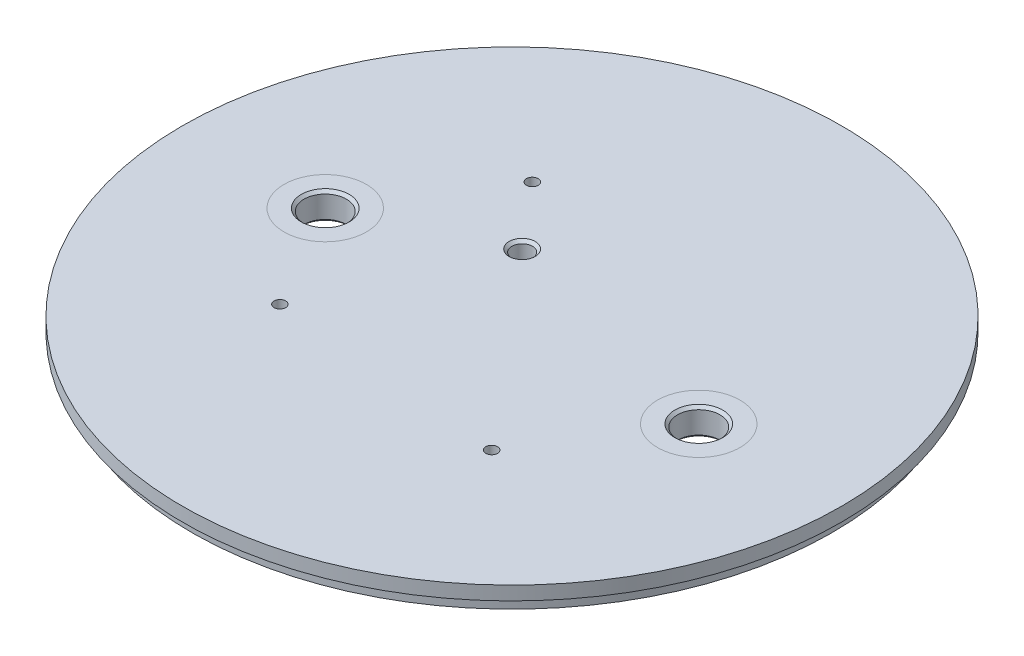
from build123d import *

# Parameters (mm, degrees)
SKETCH1_R                 = 76.2
BOSS_EXTRUDE1_DEPTH       = 6.35
TAP_DRILL_FOR_6_32_TAP1_D = 2.7051
CIRPATTERN1_COUNT         = 4
W_0_386_DIAMETER_HOLE1_D  = 9.8044
CUT_EXTRUDE4_DEPTH        = 3.175
SKETCH15_R                = 76.2
SKETCH15_R_2              = 74.041
CUT_EXTRUDE5_DEPTH        = 3.175
BODY_MOVE_COPY1_ANGLE     = 40
CHAMFER1_SIZE             = 0.635


with BuildPart() as part:
    # Sketch1 → Boss-Extrude1 (new body)
    with BuildSketch(Plane(origin=(0, 0, 0), x_dir=(1, 0, 0), z_dir=(0, 1, 0))):
        Circle(SKETCH1_R)
    extrude(amount=BOSS_EXTRUDE1_DEPTH)

    # Tap Drill for #6-32 Tap1 (through all)
    with Locations(Plane(origin=(0, 0, 0), x_dir=(-1, 0, 0), z_dir=(0, -1, 0))):
        with Locations((37.52117539, 6.615995569)):
            tap_drill_for_6_32_tap1 = Hole(TAP_DRILL_FOR_6_32_TAP1_D / 2)

    # CirPattern1: Tap Drill for #6-32 Tap1 ×4 about axis, 1 skipped
    cirpattern1_axis = Axis((0, 0, 0), (0, 1, 0))
    add([tap_drill_for_6_32_tap1.rotate(cirpattern1_axis, i * 360 / CIRPATTERN1_COUNT) for i in range(1, CIRPATTERN1_COUNT) if i not in (3,)], mode=Mode.SUBTRACT)

    # W (0.386) Diameter Hole1 (through all)
    with Locations(Plane(origin=(0, 0, 0), x_dir=(-1, 0, 0), z_dir=(0, -1, 0))):
        with Locations((-33.077799054, 27.755568986), (33.077799054, -27.755568986)):
            Hole(W_0_386_DIAMETER_HOLE1_D / 2)

    # Sketch11 → 3/16 (0.1875) Diameter Hole1 (revolve, cut)
    with BuildSketch(Plane(origin=(-18.760587695, 0, -3.307997785), x_dir=(0, 0, -1), z_dir=(1, 0, 0))):
        Polygon((0, 0), (0, 6.35), (3.01625, 6.35), (2.38125, 5.715), (2.38125, 0.635), (3.01625, 0), align=None)
    revolve(axis=Axis((-18.760587695, -6.35, -3.307997785), (0, 1, 0)), mode=Mode.SUBTRACT)

    # Sketch12 → Cut-Extrude4 (cut)
    with BuildSketch(Plane.XZ):
        with BuildLine():
            Line((19.886888313, 28.738482206), (6.498907978, 12.783308544))
            ThreePointArc((6.498907978, 12.783308544), (6.898075233, 8.220805941), (11.460577836, 8.619973196))
            Line((11.460577836, 8.619973196), (24.848558171, 24.575146858))
            ThreePointArc((24.848558171, 24.575146858), (24.449390916, 29.137649461), (19.886888313, 28.738482206))
        make_face()
    cut_extrude4 = extrude(amount=-CUT_EXTRUDE4_DEPTH, mode=Mode.SUBTRACT)

    # Mirror1: Cut-Extrude4 across plane
    add(cut_extrude4.mirror(Plane(origin=(0, 0, 0), x_dir=(-0.7660444431189792, 0, 0.6427876096865378), z_dir=(0.6427876096865379, 0, 0.7660444431189792))), mode=Mode.SUBTRACT)

    # Sketch15 → Cut-Extrude5 (cut)
    with BuildSketch(Plane.XZ):
        Circle(SKETCH15_R)
        Circle(SKETCH15_R_2, mode=Mode.SUBTRACT)
    extrude(amount=-CUT_EXTRUDE5_DEPTH, mode=Mode.SUBTRACT)


with BuildPart() as part_1:
    # Body-Move/Copy1: moved
    add(part.part.rotate(Axis((0, 0, 0), (0, -1, 0)), BODY_MOVE_COPY1_ANGLE))

    # Chamfer1
    chamfer1_edges = [part_1.edges().sort_by_distance(p)[0] for p in [
        (39.424696931, 0, -3.15107342),
        (-46.935303069, 0, -3.15107342),
        (39.424696931, 6.35, -3.15107342),
        (-46.935303069, 6.35, -3.15107342),
    ]]
    chamfer(chamfer1_edges, length=CHAMFER1_SIZE)


solid = part_1.part
